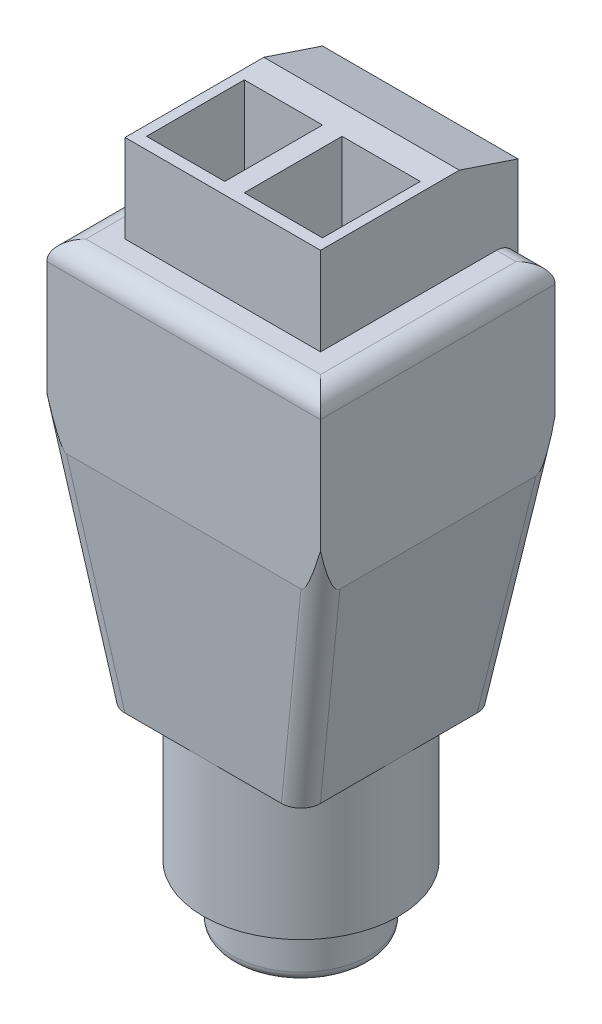
from build123d import *

# Parameters (mm, degrees)
SKETCH_1_W          = 14
SKETCH_1_H          = 12
EXTRUDE_1_DEPTH     = 9
FILLET_2_R          = 1
FILLET_3_R          = 1
SKETCH_8_W          = 10
SKETCH_8_H          = 5.607572988
CUT_EXTRUDE_2_DEPTH = 10
SKETCH_9_W          = 10
SKETCH_9_H          = 6
EXTRUDE_3_DEPTH     = 10.1
SKETCH_10_R         = 1.75
CUT_EXTRUDE_3_DEPTH = 0.5
CUT_EXTRUDE_4_DEPTH = 22.740745157
SKETCH_12_W         = 4
SKETCH_12_H         = 5
CUT_EXTRUDE_5_DEPTH = 5
EXTRUDE_5_DEPTH     = 3
SKETCH_17_R         = 5
EXTRUDE_6_DEPTH     = 7
SKETCH_14_R         = 3.5
SKETCH_14_R_2       = 3
EXTRUDE_7_DEPTH     = 10
FILLET_5_R          = 0.5
CUT_EXTRUDE_START   = -5
SKETCH_18_R         = 3
CUT_EXTRUDE_7_DEPTH = 5
FILLET_6_R          = 0.5


# Some blends are built 0.0001 mm under size
with BuildPart() as part:
    # 草图1 → 凸台-拉伸1 (new body)
    with BuildSketch(Plane(origin=(0, 0, 0), x_dir=(1, 0, 0), z_dir=(0, 1, 0))):
        with Locations((7, 6)):
            Rectangle(SKETCH_1_W, SKETCH_1_H)
    extrude(amount=EXTRUDE_1_DEPTH)

    # 圆角2
    fillet_2_edges = [part.edges().sort_by_distance(p)[0] for p in [
        (14, 9, -6),
        (7, 9, -12),
        (0, 9, -6),
        (7, 9, 0),
    ]]
    fillet(fillet_2_edges, radius=FILLET_2_R)

    # 草图4 → 放样1 section 0
    with BuildSketch(Plane.XZ):
        with BuildLine():
            Line((0, 0), (14, 0))
            Line((14, 0), (14, -12))
            Line((14, -12), (0, -12))
            Line((0, -12), (0, 0))
        make_face()
    # 草图5 → 放样1 section 1
    with BuildSketch(Plane(origin=(0, -11, 0), x_dir=(-1, 0, 0), z_dir=(0, -1, 0))):
        with BuildLine():
            Line((-2, 1), (-12, 1))
            Line((-12, 1), (-12, 11))
            Line((-12, 11), (-2, 11))
            Line((-2, 11), (-2, 1))
        make_face()
    loft()

    # 圆角3
    # the kernel refuses this fillet: 1 mm, written as the material it takes off along each edge
    with BuildSketch(Plane(origin=(14.438278825, 2.410533539, -12.219139413), x_dir=(0.015936381457793344, 0.08765009801785527, 0.9960238411119947), z_dir=(-0.1781741612749496, -0.9799578870122228, 0.0890870806374748)), Plane(origin=(14.438278825, 2.410533539, 0.219139413), x_dir=(-0.9839989676081822, 0.17744243678180333, 0.016131130616527562), z_dir=(-0.1781741612749496, -0.9799578870122228, -0.08908708063747467))) as fillet_3_piece_1:
        with BuildLine():
            CenterArc((FILLET_3_R * 0.983933522321, FILLET_3_R), FILLET_3_R, 180.927975892, 89.072024108)
            Line((-FILLET_3_R * 0.0159353215369, FILLET_3_R * 0.983804473396), (0, 0))
            Line((0, 0), (FILLET_3_R * 0.983933522321, 0))
        make_face()
    extrude(amount=16.144639772, mode=Mode.SUBTRACT)
    with BuildSketch(Plane(origin=(-0.438278825, 2.410533539, -12.219139413), x_dir=(-0.015936381457791863, 0.08765009801785537, 0.9960238411119947), z_dir=(0.1781741612749496, -0.9799578870122228, 0.08908708063747463)), Plane(origin=(-0.438278825, 2.410533539, 0.219139413), x_dir=(0.9839989676081822, 0.17744243678180333, 0.016131130616527607), z_dir=(0.1781741612749496, -0.9799578870122228, -0.0890870806374748))) as fillet_3_piece_2:
        with BuildLine():
            CenterArc((FILLET_3_R * 0.983933522321, -FILLET_3_R), FILLET_3_R, 90, 89.072024108)
            Line((-FILLET_3_R * 0.0159353215369, -FILLET_3_R * 0.983804473396), (0, 0))
            Line((0, 0), (FILLET_3_R * 0.983933522321, 0))
        make_face()
    extrude(amount=16.144639772, mode=Mode.SUBTRACT)

    # 草图8 → 切除-拉伸2 (cut)
    with BuildSketch(Plane(origin=(0, 0, -12), x_dir=(-1, 0, 0), z_dir=(0, 0, -1))):
        with Locations((-7, 10.303786494)):
            Rectangle(SKETCH_8_W, SKETCH_8_H)
    extrude(amount=-CUT_EXTRUDE_2_DEPTH, mode=Mode.SUBTRACT)

    # 草图9 → 凸台-拉伸3 (add)
    with BuildSketch(Plane(origin=(0, 0, -2), x_dir=(-1, 0, 0), z_dir=(0, 0, -1))):
        with Locations((-7, 10.5)):
            Rectangle(SKETCH_9_W, SKETCH_9_H)
    extrude(amount=EXTRUDE_3_DEPTH)

    # 草图10 → 切除-拉伸3 (cut)
    with BuildSketch(Plane(origin=(0, 0, -12.1), x_dir=(-1, 0, 0), z_dir=(0, 0, -1))):
        with Locations((-4.5, 10)):
            Circle(SKETCH_10_R)
        with Locations((-9.5, 10)):
            Circle(SKETCH_10_R)
    extrude(amount=-CUT_EXTRUDE_3_DEPTH, mode=Mode.SUBTRACT)

    # 草图11 → 切除-拉伸4 (cut, through all)
    with BuildSketch(Plane.ZY.offset(-2)):
        Polygon((-12.1, 12.5), (-12.1, 13.5), (-9.1, 13.5), align=None)
    extrude(amount=-CUT_EXTRUDE_4_DEPTH, mode=Mode.SUBTRACT)

    # 草图12 → 切除-拉伸5 (cut)
    with BuildSketch(Plane(origin=(0, 13.5, 0), x_dir=(1, 0, 0), z_dir=(0, 1, 0))):
        with Locations((4.5, 5.1)):
            Rectangle(SKETCH_12_W, SKETCH_12_H)
        with Locations((9.5, 5.1)):
            Rectangle(SKETCH_12_W, SKETCH_12_H)
    extrude(amount=-CUT_EXTRUDE_5_DEPTH, mode=Mode.SUBTRACT)

    # 草图15 → 凸台-拉伸5 (add)
    with BuildSketch(Plane.XZ.offset(11)):
        with BuildLine():
            Line((6.95, -5.251668523), (6.95, -6.748331477))
            ThreePointArc((6.95, -6.748331477), (6.25, -6), (6.95, -5.251668523))
        make_face()
        with BuildLine():
            Line((7.05, -5.251668523), (7.05, -6.748331477))
            ThreePointArc((7.05, -6.748331477), (7.75, -6), (7.05, -5.251668523))
        make_face()
    extrude(amount=EXTRUDE_5_DEPTH)

    # 草图17 → 凸台-拉伸6 (add)
    with BuildSketch(Plane.XZ.offset(11)):
        with Locations(Location((7, -6, 0), (0, 0, 270))):
            Circle(SKETCH_17_R)
    extrude(amount=EXTRUDE_6_DEPTH)

    # 草图14 → 凸台-拉伸7 (add)
    with BuildSketch(Plane.XZ.offset(11)):
        with Locations(Location((7, -6, 0), (0, 0, 270))):
            Circle(SKETCH_14_R)
        with Locations(Location((7, -6, 0), (0, 0, 270))):
            Circle(SKETCH_14_R_2, mode=Mode.SUBTRACT)
    extrude(amount=EXTRUDE_7_DEPTH)

    # 圆角5
    fillet_5_edges = [part.edges().sort_by_distance(p)[0] for p in [
        (7, -21, -2.5),
    ]]
    fillet(fillet_5_edges, radius=FILLET_5_R - 0.0001)  # a hair under: the kernel refuses the full size

    # 草图18 → 切除-拉伸7 (cut)
    with BuildSketch(Plane.XZ.offset(18).offset(CUT_EXTRUDE_START)):
        with Locations(Location((7, -6, 0), (0, 0, 270))):
            Circle(SKETCH_18_R)
        with BuildLine():
            Line((6.357738371, -5.9), (7.642261629, -5.9))
            ThreePointArc((7.642261629, -5.9), (7, -5.35), (6.357738371, -5.9))
        make_face(mode=Mode.SUBTRACT)
        with BuildLine():
            Line((6.357738371, -6.1), (7.642261629, -6.1))
            ThreePointArc((7.642261629, -6.1), (7, -6.65), (6.357738371, -6.1))
        make_face(mode=Mode.SUBTRACT)
    extrude(amount=CUT_EXTRUDE_7_DEPTH, mode=Mode.SUBTRACT)

    # 圆角6
    fillet_6_edges = [part.edges().sort_by_distance(p)[0] for p in [
        (7, -18, -5.35),
        (7, -18, -6.65),
    ]]
    fillet(fillet_6_edges, radius=FILLET_6_R)


solid = part.part
